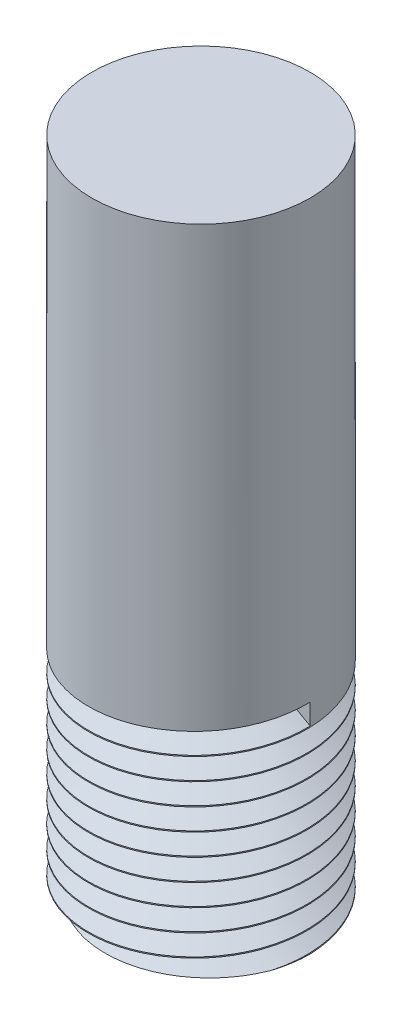
from build123d import *

# Parameters (mm, degrees)
SKETCH1_R           = 5
BOSS_EXTRUDE1_DEPTH = 30
CUT_SWEEP1_PITCH    = 1


with BuildPart() as part:
    # Sketch1 → Boss-Extrude1 (new body)
    with BuildSketch(Plane(origin=(0, 0, 0), x_dir=(1, 0, 0), z_dir=(0, 1, 0))):
        with Locations(Location((0, 0, 0), (0, 0, 270))):
            Circle(SKETCH1_R)
    extrude(amount=BOSS_EXTRUDE1_DEPTH)

    # Cut-Sweep1: the profile of Sketch3 profile screwed along a right-hand helix of 10 turns, 8 arcs to a turn; built about Z, then put on its axis
    cut_sweep1_z = Axis((0, 0, 0), (0, 0, 1))
    cut_sweep1_corners = [(4.177275866, 0, -0.475), (5.0003, 0, -0.950173205), (5.0003, 0, 0.000173205)]
    with BuildLine(mode=Mode.PRIVATE) as cut_sweep1_profile:
        Line(cut_sweep1_corners[0], cut_sweep1_corners[1])
        Line(cut_sweep1_corners[1], cut_sweep1_corners[2])
        Line(cut_sweep1_corners[2], cut_sweep1_corners[0])
    cut_sweep1_cap = Face(cut_sweep1_profile.wire())
    cut_sweep1_turn_angles = [0, 22.5, 45, 67.5, 90, 112.5, 135, 157.5, 180, 202.5, 225, 247.5, 270, 292.5, 315, 337.5, 360]
    cut_sweep1_turn_weights = [1, 0.9238795325112867, 1, 0.9238795325112867, 1, 0.9238795325112867, 1, 0.9238795325112867, 1, 0.9238795325112867, 1, 0.9238795325112867, 1, 0.9238795325112867, 1, 0.9238795325112867, 1]
    cut_sweep1_turn_rails = [Edge.make_bspline([Vector(p[0], p[1], 0).rotate(cut_sweep1_z, cut_sweep1_turn_angles[k]) / cut_sweep1_turn_weights[k] + Vector(0, 0, p[2] + CUT_SWEEP1_PITCH * cut_sweep1_turn_angles[k] / 360) for k in range(17)], [0, 0, 0, 1, 1, 2, 2, 3, 3, 4, 4, 5, 5, 6, 6, 7, 7, 8, 8, 8], 2, cut_sweep1_turn_weights) for p in cut_sweep1_corners]
    cut_sweep1_turn_sides = [Face.make_surface_from_curves(cut_sweep1_turn_rails[p[0]], cut_sweep1_turn_rails[p[1]]) for p in [(0, 1), (1, 2), (2, 0)]]
    cut_sweep1 = Plane(origin=(0, 0, 0), x_dir=(1, 0, 0), z_dir=(0, 1, 0)) * Solid(Shell([*[p.moved(Location((0, 0, CUT_SWEEP1_PITCH * i))) for i in range(10) for p in cut_sweep1_turn_sides], cut_sweep1_cap, cut_sweep1_cap.rotate(cut_sweep1_z, 3600).moved(Location((0, 0, CUT_SWEEP1_PITCH * 3600 / 360)))]))
    add(cut_sweep1, mode=Mode.SUBTRACT)


solid = part.part
